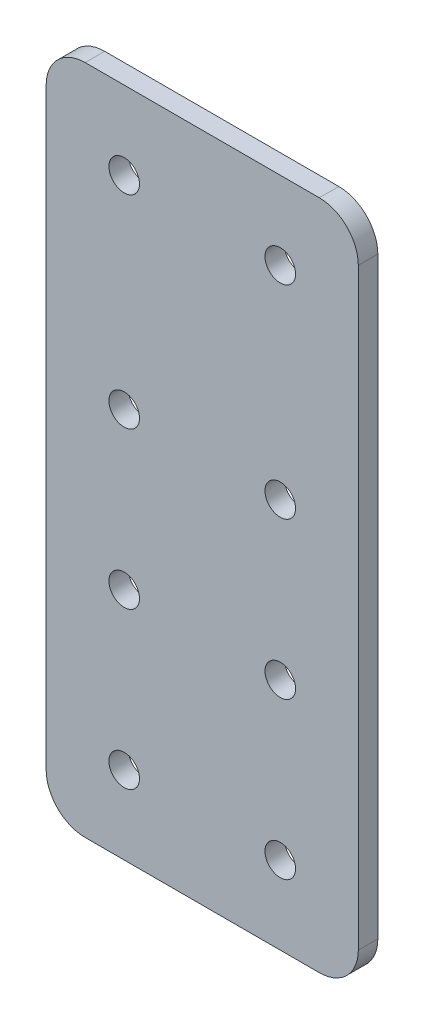
from build123d import *

# Parameters (mm, degrees)
SKETCH2_W           = 50.8
SKETCH2_H           = 109.22
BOSS_EXTRUDE1_DEPTH = 3.175
SKETCH3_R           = 2.4892
CUT_EXTRUDE1_DEPTH  = 121.497838259
FILLET1_R           = 6.35


with BuildPart() as part:
    # Sketch2 → Boss-Extrude1 (new body)
    with BuildSketch(Plane.XY):
        with Locations((25.4, 54.61)):
            Rectangle(SKETCH2_W, SKETCH2_H)
    extrude(amount=-BOSS_EXTRUDE1_DEPTH)

    # Sketch3 → Cut-Extrude1 (cut, through all)
    with BuildSketch(Plane.XY):
        with Locations((12.7, 96.52)):
            Circle(SKETCH3_R)
        with Locations((38.1, 96.52)):
            Circle(SKETCH3_R)
        with Locations((12.7, 63.5)):
            Circle(SKETCH3_R)
        with Locations((12.7, 38.1)):
            Circle(SKETCH3_R)
        with Locations((12.7, 12.7)):
            Circle(SKETCH3_R)
        with Locations((12.7, -12.7)):
            Circle(SKETCH3_R)
        with Locations((12.7, -38.1)):
            Circle(SKETCH3_R)
        with Locations((38.1, 38.1)):
            Circle(SKETCH3_R)
        with Locations((38.1, 12.7)):
            Circle(SKETCH3_R)
        with Locations((38.1, -12.7)):
            Circle(SKETCH3_R)
        with Locations((38.1, -38.1)):
            Circle(SKETCH3_R)
        with Locations((38.1, 63.5)):
            Circle(SKETCH3_R)
    extrude(amount=-CUT_EXTRUDE1_DEPTH, mode=Mode.SUBTRACT)

    # Fillet1
    fillet1_edges = [part.edges().sort_by_distance(p)[0] for p in [
        (0, 0, -1.5875),
        (0, 109.22, -1.5875),
        (50.8, 0, -1.5875),
        (50.8, 109.22, -1.5875),
    ]]
    fillet(fillet1_edges, radius=FILLET1_R)


solid = part.part
